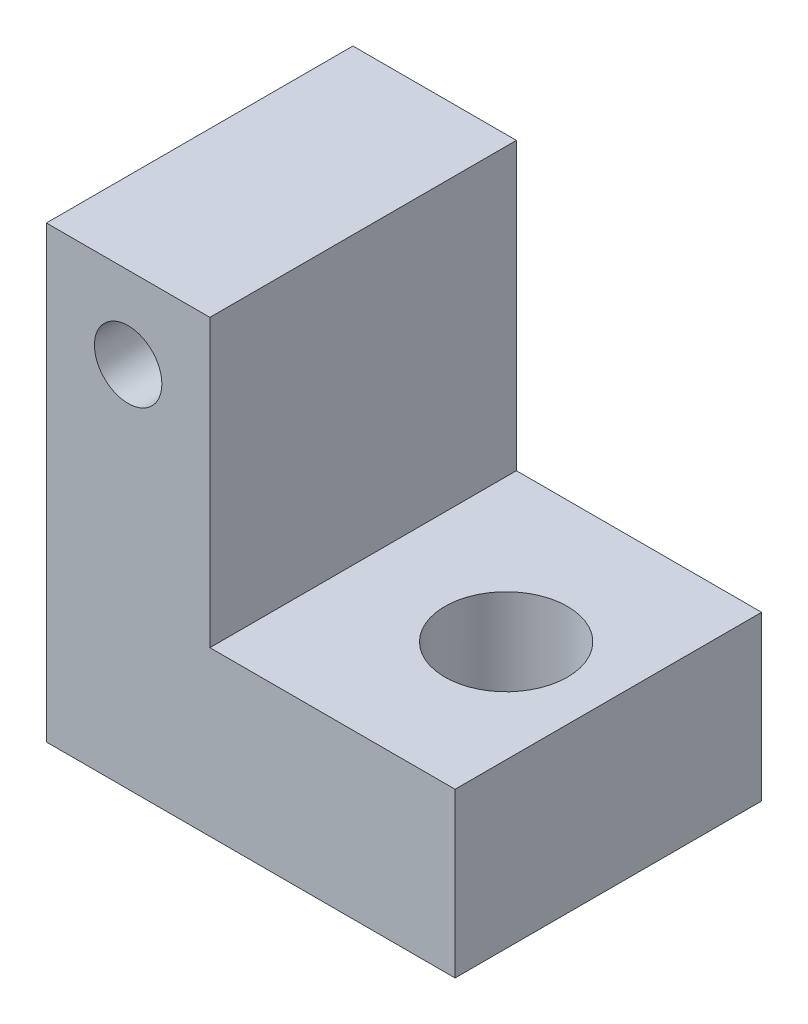
from build123d import *

# Parameters (mm, degrees)
ESTRUSIONE_ESTRUSIONE1_DEPTH = 15
SCHIZZO2_R                   = 3
TAGLIO_ESTRUSIONE1_DEPTH     = 15
FORO_FILETTATO_M4_1_D        = 3.3


with BuildPart() as part:
    # Schizzo1 → Estrusione-Estrusione1 (new body)
    with BuildSketch(Plane.XY):
        Polygon((0, 0), (-20, 0), (-20, 22), (-12, 22), (-12, 8), (0, 8), align=None)
    extrude(amount=ESTRUSIONE_ESTRUSIONE1_DEPTH)

    # Schizzo2 → Taglio-Estrusione1 (cut)
    with BuildSketch(Plane.XZ):
        with Locations((-5, 7.5)):
            Circle(SCHIZZO2_R)
    extrude(amount=-TAGLIO_ESTRUSIONE1_DEPTH, mode=Mode.SUBTRACT)

    # Foro filettato M4-1 (through all)
    with Locations(Plane.XY.offset(15)):
        with Locations((-16, 18)):
            Hole(FORO_FILETTATO_M4_1_D / 2)


solid = part.part
